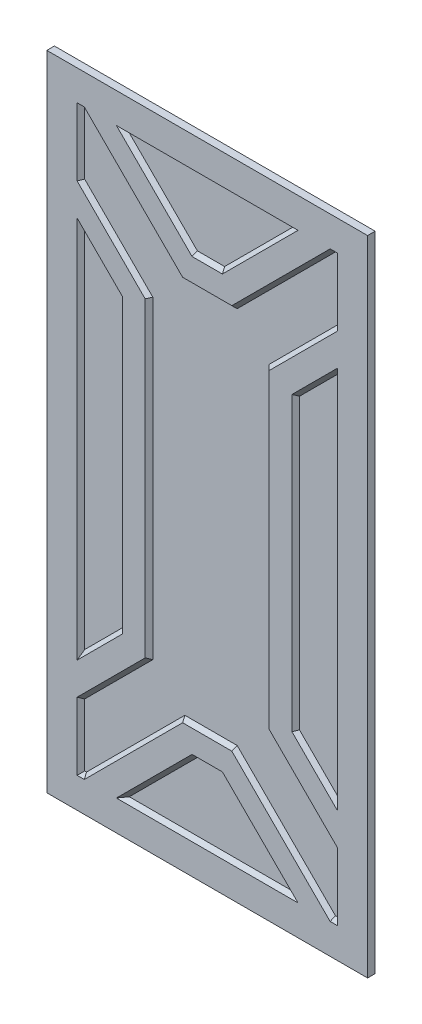
from build123d import *

# Parameters (mm, degrees)
ESQUISSE1_W             = 424
ESQUISSE1_H             = 850
BOSS_EXTRU_1_DEPTH      = 10
ENL_V_MAT_EXTRU_1_DEPTH = 5
CHANFREIN1_SIZE         = 5


with BuildPart() as part:
    # Esquisse1 → Boss.-Extru.1 (new body)
    with BuildSketch(Plane.XY):
        with Locations((212, 425)):
            Rectangle(ESQUISSE1_W, ESQUISSE1_H)
    extrude(amount=BOSS_EXTRU_1_DEPTH)

    # Esquisse2 → Enlèv. mat.-Extru.1 (cut)
    with BuildSketch(Plane.XY.offset(10)):
        Polygon((100, 231.923881554), (100, 618.076118446), (40, 678.076118446), (40, 171.923881554), align=None)
        Polygon((191.923881554, 710), (232.076118446, 710), (332.076118446, 810), (91.923881554, 810), align=None)
        Polygon((40, 810), (40, 720.502525317), (130, 630.502525317), (130, 219.497474683), (40, 129.497474683), (40, 40), (49.497474683, 40), (179.497474683, 170), (244.502525317, 170), (374.502525317, 40), (384, 40), (384, 129.497474683), (294, 219.497474683), (294, 630.502525317), (384, 720.502525317), (384, 810), (374.502525317, 810), (244.502525317, 680), (179.497474683, 680), (49.497474683, 810), align=None)
        Polygon((324, 231.923881554), (324, 618.076118446), (384, 678.076118446), (384, 171.923881554), align=None)
        Polygon((332.076118446, 40), (91.923881554, 40), (191.923881554, 140), (232.076118446, 140), align=None)
    extrude(amount=-ENL_V_MAT_EXTRU_1_DEPTH, mode=Mode.SUBTRACT)

    # Chanfrein1
    chanfrein1_edges = [part.edges().sort_by_distance(p)[0] for p in [
        (212, 40, 5),
        (141.923881554, 90, 5),
        (212, 140, 5),
        (282.076118446, 90, 5),
        (40, 425, 5),
        (70, 648.076118446, 5),
        (100, 425, 5),
        (70, 201.923881554, 5),
        (384, 425, 5),
        (354, 201.923881554, 5),
        (324, 425, 5),
        (354, 648.076118446, 5),
        (114.497474683, 745, 5),
        (212, 680, 5),
        (309.502525317, 745, 5),
        (379.251262658, 810, 5),
        (384, 765.251262658, 5),
        (339, 675.502525317, 5),
        (294, 425, 5),
        (339, 174.497474683, 5),
        (384, 84.748737342, 5),
        (379.251262658, 40, 5),
        (309.502525317, 105, 5),
        (212, 170, 5),
        (114.497474683, 105, 5),
        (44.748737342, 40, 5),
        (40, 84.748737342, 5),
        (85, 174.497474683, 5),
        (130, 425, 5),
        (85, 675.502525317, 5),
        (40, 765.251262658, 5),
        (44.748737342, 810, 5),
        (212, 810, 5),
        (282.076118446, 760, 5),
        (212, 710, 5),
        (141.923881554, 760, 5),
    ]]
    chamfer(chanfrein1_edges, length=CHANFREIN1_SIZE - 0.0001)  # a hair under: the kernel refuses the full size


solid = part.part
